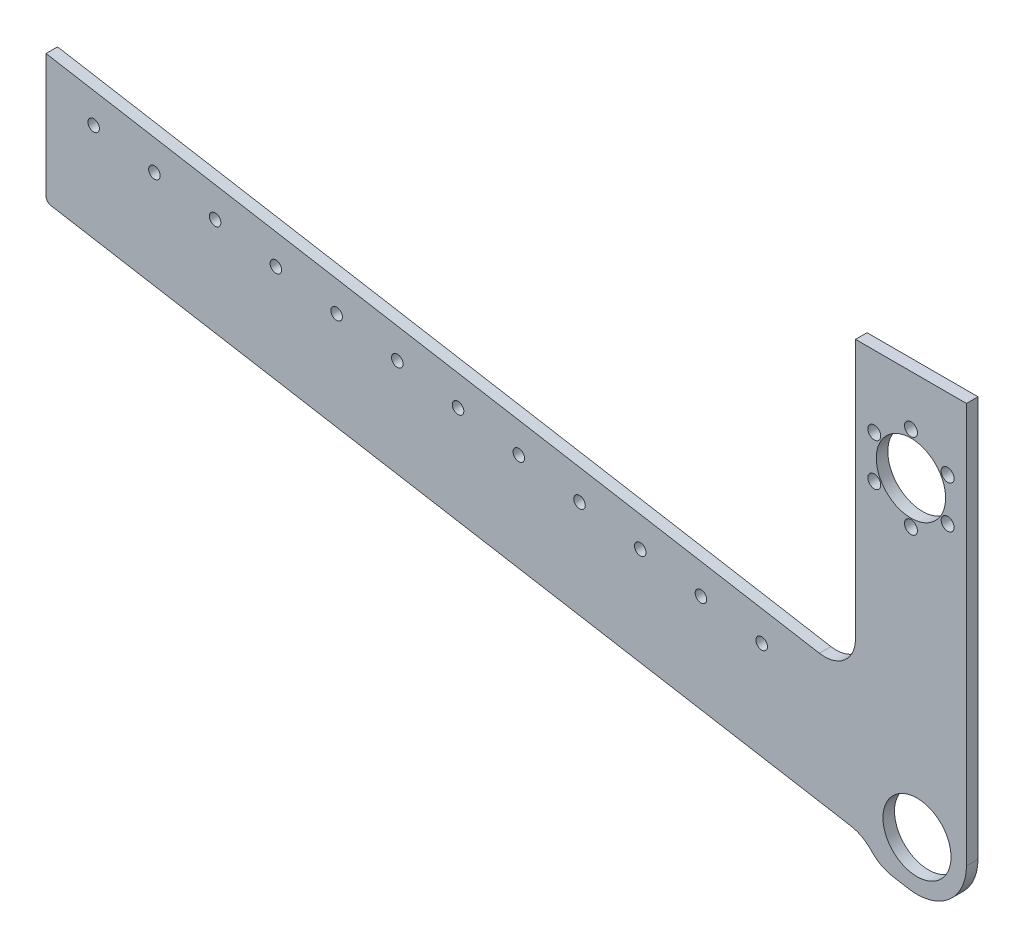
from build123d import *

# Parameters (mm, degrees)
SKETCH1_R           = 14.0335
SKETCH1_R_2         = 2.38125
SKETCH1_R_3         = 14.2875
SKETCH1_R_4         = 2.667
BOSS_EXTRUDE1_DEPTH = 4.7625


with BuildPart() as part:
    # Sketch1 → Boss-Extrude1 (new body)
    with BuildSketch(Plane.XY):
        with BuildLine():
            Line((165.542350471, -12.850928795), (158.864493489, -11.70515089))
            ThreePointArc((158.864493489, -11.70515089), (154.154566121, -10.06953751), (150.224583517, -7.001332225))
            ThreePointArc((150.224583517, -7.001332225), (146.294597206, -3.933124046), (141.584665397, -2.297509122))
            Line((141.584665397, -2.297509122), (-187.944818486, 54.242725653))
            ThreePointArc((-187.944818486, 54.242725653), (-189.457270687, 55.108983561), (-190.055285337, 56.746143572))
            Line((-190.055285337, 56.746143572), (-190.055285337, 107.546143572))
            Line((-190.055285337, 107.546143572), (128.771239178, 52.842308466))
            ThreePointArc((128.771239178, 52.842308466), (139.104704977, 55.649471309), (143.618904922, 65.359398058))
            Line((143.618904922, 65.359398058), (143.618904922, 172.339))
            Line((143.618904922, 172.339), (189.37285399, 172.339))
            Line((189.37285399, 172.339), (189.37285399, 7.239))
            ThreePointArc((189.37285399, 7.239), (182.127563077, -8.345432433), (165.542350471, -12.850928795))
        make_face()
        with Locations((168.98935399, 7.239)):
            Circle(SKETCH1_R, mode=Mode.SUBTRACT)
        with Locations((104.970773751, 44.478080628)):
            Circle(SKETCH1_R_2, mode=Mode.SUBTRACT)
        with Locations((79.936594567, 48.773412116)):
            Circle(SKETCH1_R_2, mode=Mode.SUBTRACT)
        with Locations((54.902415383, 53.068743605)):
            Circle(SKETCH1_R_2, mode=Mode.SUBTRACT)
        with Locations((29.868236199, 57.364075093)):
            Circle(SKETCH1_R_2, mode=Mode.SUBTRACT)
        with Locations((4.834057015, 61.659406581)):
            Circle(SKETCH1_R_2, mode=Mode.SUBTRACT)
        with Locations((-20.200122168, 65.95473807)):
            Circle(SKETCH1_R_2, mode=Mode.SUBTRACT)
        with Locations((-45.234301352, 70.250069558)):
            Circle(SKETCH1_R_2, mode=Mode.SUBTRACT)
        with Locations((-70.268480536, 74.545401047)):
            Circle(SKETCH1_R_2, mode=Mode.SUBTRACT)
        with Locations((-170.405197271, 91.726727)):
            Circle(SKETCH1_R_2, mode=Mode.SUBTRACT)
        with Locations((-145.371018087, 87.431395512)):
            Circle(SKETCH1_R_2, mode=Mode.SUBTRACT)
        with Locations((-120.336838903, 83.136064023)):
            Circle(SKETCH1_R_2, mode=Mode.SUBTRACT)
        with Locations((-95.30265972, 78.840732535)):
            Circle(SKETCH1_R_2, mode=Mode.SUBTRACT)
        with Locations((166.495879456, 134.239)):
            Circle(SKETCH1_R_3, mode=Mode.SUBTRACT)
        with Locations((166.495879456, 151.7015)):
            Circle(SKETCH1_R_4, mode=Mode.SUBTRACT)
        with Locations((181.61884807, 142.97025)):
            Circle(SKETCH1_R_4, mode=Mode.SUBTRACT)
        with Locations((181.61884807, 125.50775)):
            Circle(SKETCH1_R_4, mode=Mode.SUBTRACT)
        with Locations((166.495879456, 116.7765)):
            Circle(SKETCH1_R_4, mode=Mode.SUBTRACT)
        with Locations((151.372910843, 125.50775)):
            Circle(SKETCH1_R_4, mode=Mode.SUBTRACT)
        with Locations((151.372910843, 142.97025)):
            Circle(SKETCH1_R_4, mode=Mode.SUBTRACT)
    extrude(amount=BOSS_EXTRUDE1_DEPTH)


solid = part.part
